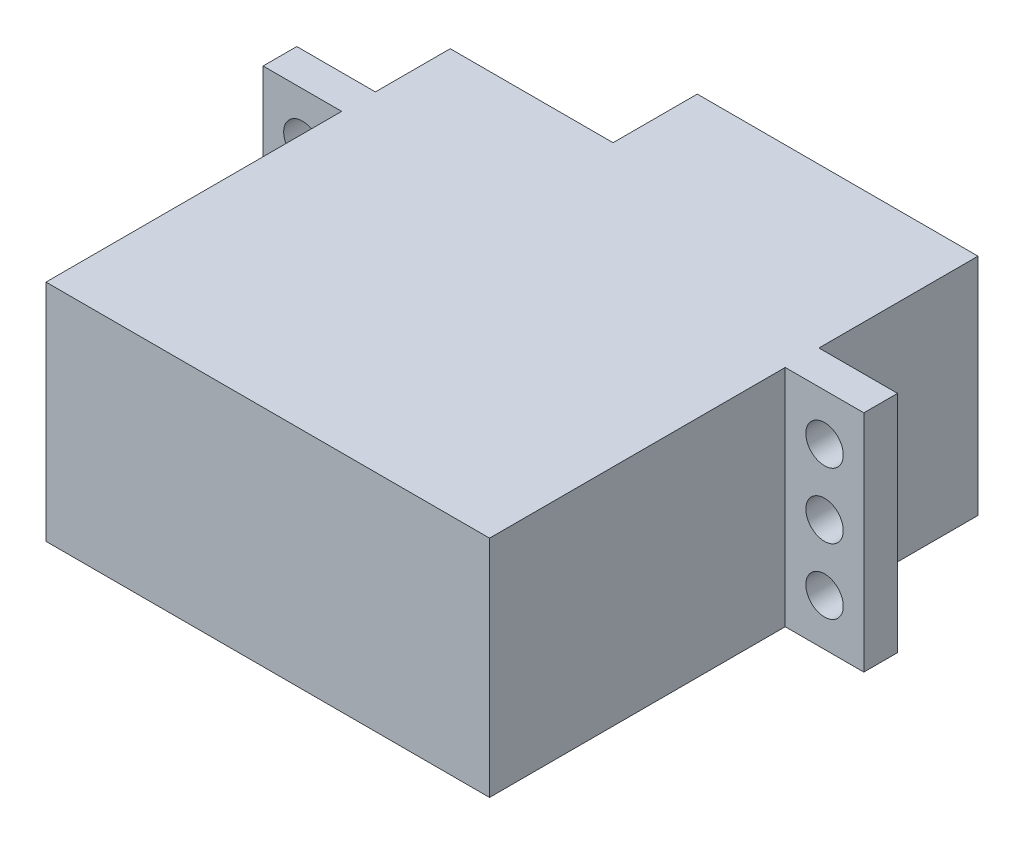
from build123d import *

# Parameters (mm, degrees)
SKETCH1_W           = 23.7
SKETCH1_H           = 12
BOSS_EXTRUDE1_DEPTH = 21.6
SKETCH2_W           = 32.1
SKETCH2_H           = 12
SKETCH2_R           = 1
BOSS_EXTRUDE2_DEPTH = 1.8
SKETCH3_W           = 15
SKETCH3_H           = 12
BOSS_EXTRUDE3_DEPTH = 4.5
SKETCH4_R           = 2.4
BOSS_EXTRUDE4_DEPTH = 3.2


with BuildPart() as part:
    # Sketch1 → Boss-Extrude1 (new body)
    with BuildSketch(Plane.XY):
        with Locations((11.85, -6)):
            Rectangle(SKETCH1_W, SKETCH1_H)
    extrude(amount=BOSS_EXTRUDE1_DEPTH)

    # Sketch2 → Boss-Extrude2 (add)
    with BuildSketch(Plane(origin=(0, 0, 4), x_dir=(-1, 0, 0), z_dir=(0, 0, -1))):
        with Locations((-11.85, -6)):
            Rectangle(SKETCH2_W, SKETCH2_H)
        with Locations((2.1, -2.5)):
            Circle(SKETCH2_R, mode=Mode.SUBTRACT)
        with Locations((-25.8, -2.5)):
            Circle(SKETCH2_R, mode=Mode.SUBTRACT)
        with Locations((-25.8, -6)):
            Circle(SKETCH2_R, mode=Mode.SUBTRACT)
        with Locations((-25.8, -9.5)):
            Circle(SKETCH2_R, mode=Mode.SUBTRACT)
        with Locations((2.1, -6)):
            Circle(SKETCH2_R, mode=Mode.SUBTRACT)
        with Locations((2.1, -9.5)):
            Circle(SKETCH2_R, mode=Mode.SUBTRACT)
    extrude(amount=-BOSS_EXTRUDE2_DEPTH)

    # Sketch3 → Boss-Extrude3 (add)
    with BuildSketch(Plane(origin=(0, 0, 0), x_dir=(-1, 0, 0), z_dir=(0, 0, -1))):
        with Locations((-16.2, -6)):
            Rectangle(SKETCH3_W, SKETCH3_H)
    extrude(amount=BOSS_EXTRUDE3_DEPTH)

    # Sketch4 → Boss-Extrude4 (add)
    with BuildSketch(Plane(origin=(0, 0, -4.5), x_dir=(-1, 0, 0), z_dir=(0, 0, -1))):
        with Locations((-16.7, -6)):
            Circle(SKETCH4_R)
    extrude(amount=BOSS_EXTRUDE4_DEPTH)


solid = part.part
